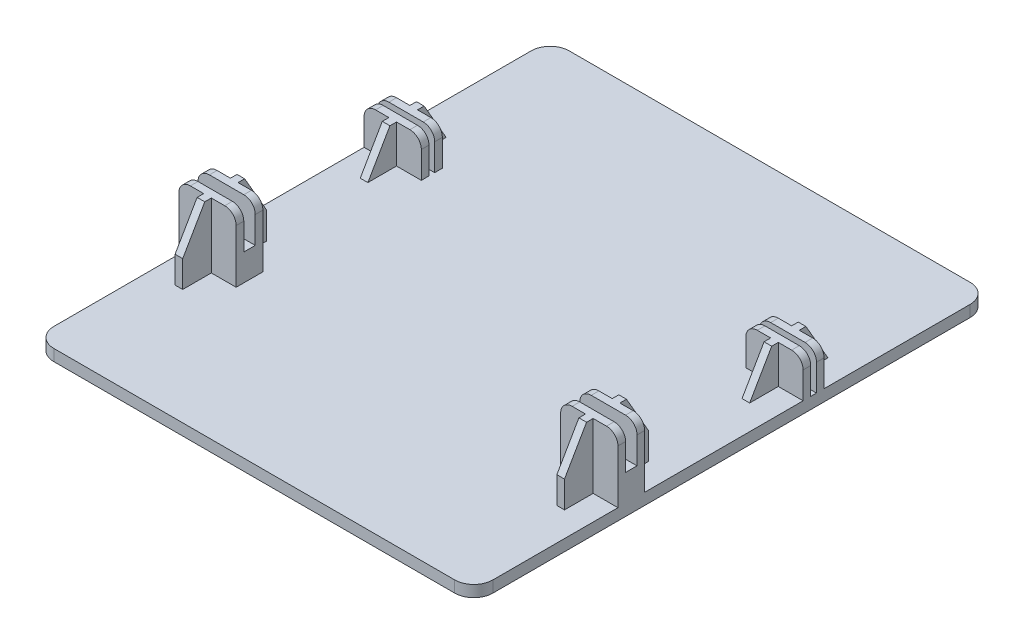
from build123d import *
from OCP.BRepFilletAPI import BRepFilletAPI_MakeChamfer

# Parameters (mm, degrees)
ESQUISSE1_W                    = 115
ESQUISSE1_H                    = 135
BOSS_EXTRU_1_DEPTH             = 3
BOSS_EXTRU_2_DEPTH             = 10
BOSS_EXTRU_3_DEPTH             = 7
ESQUISSE5_W                    = 15
ESQUISSE5_H                    = 3
BOSS_EXTRU_4_DEPTH             = 7
CHANFREIN1_SIZE                = 5.773502692
CHANFREIN1_SIZE_2              = 10
CONG_1_R                       = 3
CHANFREIN1_OF_SYM_TRIE1_SIZE   = 5.773502692
CHANFREIN1_OF_SYM_TRIE1_SIZE_2 = 10
CONG_1_OF_SYM_TRIE1_R          = 3
CONG_2_R                       = 5


with BuildPart() as part:
    # Esquisse1 → Boss.-Extru.1 (new body)
    with BuildSketch(Plane(origin=(0, 0, 0), x_dir=(1, 0, 0), z_dir=(0, 1, 0))):
        Rectangle(ESQUISSE1_W, ESQUISSE1_H)
    extrude(amount=BOSS_EXTRU_1_DEPTH)

    # Esquisse2 → Boss.-Extru.2 (add)
    with BuildSketch(Plane(origin=(0, 3, 0), x_dir=(1, 0, 0), z_dir=(0, 1, 0))):
        Polygon((-57.5, 24.25), (-51, 24.25), (-51, 31.75), (-49, 31.75), (-49, 24.25), (-42.5, 24.25), (-42.5, 22.25), (-57.5, 22.25), align=None)
        Polygon((-42.5, 18.75), (-42.5, 20.75), (-57.5, 20.75), (-57.5, 18.75), (-51, 18.75), (-51, 11.25), (-49, 11.25), (-49, 18.75), align=None)
        Polygon((-51, -22.75), (-51, -15.25), (-49, -15.25), (-49, -22.75), (-42.5, -22.75), (-42.5, -24.75), (-57.5, -24.75), (-57.5, -22.75), align=None)
        Polygon((-57.5, -29.75), (-51, -29.75), (-51, -37.25), (-49, -37.25), (-49, -29.75), (-42.5, -29.75), (-42.5, -27.75), (-57.5, -27.75), align=None)
    boss_extru_2 = extrude(amount=BOSS_EXTRU_2_DEPTH)

    # Esquisse4 → Boss.-Extru.3 (add)
    with BuildSketch(Plane(origin=(0, 13, 0), x_dir=(1, 0, 0), z_dir=(0, 1, 0))):
        Polygon((-57.5, -27.75), (-57.5, -29.75), (-51, -29.75), (-51, -37.25), (-49, -37.25), (-49, -29.75), (-42.5, -29.75), (-42.5, -27.75), align=None)
        Polygon((-51, -22.75), (-57.5, -22.75), (-57.5, -24.75), (-42.5, -24.75), (-42.5, -22.75), (-49, -22.75), (-49, -15.25), (-51, -15.25), align=None)
    boss_extru_3 = extrude(amount=BOSS_EXTRU_3_DEPTH)

    # Esquisse5 → Boss.-Extru.4 (add)
    with BuildSketch(Plane(origin=(0, 3, 0), x_dir=(1, 0, 0), z_dir=(0, 1, 0))):
        with Locations((-50, -26.25)):
            Rectangle(ESQUISSE5_W, ESQUISSE5_H)
    boss_extru_4 = extrude(amount=BOSS_EXTRU_4_DEPTH)

    # Chanfrein1
    chanfrein1_edges_1 = [part.edges().sort_by_distance(p)[0] for p in [
        (-50, 13, -31.75),
    ]]
    chanfrein1_side_1 = [part.faces().sort_by_distance(p)[0] for p in [
        (-50, 13, -31.634529946),
    ]]
    chanfrein1_edges_2 = [part.edges().sort_by_distance(p)[0] for p in [
        (-50, 13, -11.25),
    ]]
    chanfrein1_side_2 = [part.faces().sort_by_distance(p)[0] for p in [
        (-50, 13, -11.365470054),
    ]]
    chanfrein1_edges_3 = [part.edges().sort_by_distance(p)[0] for p in [
        (-50, 20, 37.25),
    ]]
    chanfrein1_side_3 = [part.faces().sort_by_distance(p)[0] for p in [
        (-50, 20, 37.134529946),
    ]]
    chanfrein1_edges_4 = [part.edges().sort_by_distance(p)[0] for p in [
        (-50, 20, 15.25),
    ]]
    chanfrein1_side_4 = [part.faces().sort_by_distance(p)[0] for p in [
        (-50, 20, 15.365470054),
    ]]
    chanfrein1 = BRepFilletAPI_MakeChamfer(part.part.solid().wrapped)
    for e in chanfrein1_edges_1:
        chanfrein1.Add(CHANFREIN1_SIZE - 0.0001, CHANFREIN1_SIZE_2 - 0.0001, e.wrapped, chanfrein1_side_1[0].wrapped)
    for e in chanfrein1_edges_2:
        chanfrein1.Add(CHANFREIN1_SIZE - 0.0001, CHANFREIN1_SIZE_2 - 0.0001, e.wrapped, chanfrein1_side_2[0].wrapped)
    for e in chanfrein1_edges_3:
        chanfrein1.Add(CHANFREIN1_SIZE - 0.0001, CHANFREIN1_SIZE_2 - 0.0001, e.wrapped, chanfrein1_side_3[0].wrapped)
    for e in chanfrein1_edges_4:
        chanfrein1.Add(CHANFREIN1_SIZE - 0.0001, CHANFREIN1_SIZE_2 - 0.0001, e.wrapped, chanfrein1_side_4[0].wrapped)
    add(Compound.cast(chanfrein1.Shape()), mode=Mode.REPLACE)  # a hair under: the kernel refuses the full size

    # Congé1
    cong_1_edges = [part.edges().sort_by_distance(p)[0] for p in [
        (-57.5, 20, 28.75),
        (-42.5, 20, 28.75),
        (-57.5, 20, 23.75),
        (-42.5, 20, 23.75),
        (-57.5, 13, -23.25),
        (-42.5, 13, -23.25),
        (-42.5, 13, -19.75),
        (-57.5, 13, -19.75),
    ]]
    fillet(cong_1_edges, radius=CONG_1_R)

    # Symétrie1: Boss.-Extru.2, Boss.-Extru.3, Boss.-Extru.4 across plane
    add(boss_extru_2.mirror(Plane(origin=(0, 0, 0), x_dir=(0, 0, 1), z_dir=(1, 0, 0))))
    add(boss_extru_3.mirror(Plane(origin=(0, 0, 0), x_dir=(0, 0, 1), z_dir=(1, 0, 0))))
    add(boss_extru_4.mirror(Plane(origin=(0, 0, 0), x_dir=(0, 0, 1), z_dir=(1, 0, 0))))

    # Chanfrein1 of Symétrie1
    chanfrein1_of_sym_trie1_edges_1 = [part.edges().sort_by_distance(p)[0] for p in [
        (50, 13, -31.75),
    ]]
    chanfrein1_of_sym_trie1_side_1 = [part.faces().sort_by_distance(p)[0] for p in [
        (50, 13, -31.634529946),
    ]]
    chanfrein1_of_sym_trie1_edges_2 = [part.edges().sort_by_distance(p)[0] for p in [
        (50, 13, -11.25),
    ]]
    chanfrein1_of_sym_trie1_side_2 = [part.faces().sort_by_distance(p)[0] for p in [
        (50, 13, -11.365470054),
    ]]
    chanfrein1_of_sym_trie1_edges_3 = [part.edges().sort_by_distance(p)[0] for p in [
        (50, 20, 37.25),
    ]]
    chanfrein1_of_sym_trie1_side_3 = [part.faces().sort_by_distance(p)[0] for p in [
        (50, 20, 37.134529946),
    ]]
    chanfrein1_of_sym_trie1_edges_4 = [part.edges().sort_by_distance(p)[0] for p in [
        (50, 20, 15.25),
    ]]
    chanfrein1_of_sym_trie1_side_4 = [part.faces().sort_by_distance(p)[0] for p in [
        (50, 20, 15.365470054),
    ]]
    chanfrein1_of_sym_trie1 = BRepFilletAPI_MakeChamfer(part.part.solid().wrapped)
    for e in chanfrein1_of_sym_trie1_edges_1:
        chanfrein1_of_sym_trie1.Add(CHANFREIN1_OF_SYM_TRIE1_SIZE - 0.0001, CHANFREIN1_OF_SYM_TRIE1_SIZE_2 - 0.0001, e.wrapped, chanfrein1_of_sym_trie1_side_1[0].wrapped)
    for e in chanfrein1_of_sym_trie1_edges_2:
        chanfrein1_of_sym_trie1.Add(CHANFREIN1_OF_SYM_TRIE1_SIZE - 0.0001, CHANFREIN1_OF_SYM_TRIE1_SIZE_2 - 0.0001, e.wrapped, chanfrein1_of_sym_trie1_side_2[0].wrapped)
    for e in chanfrein1_of_sym_trie1_edges_3:
        chanfrein1_of_sym_trie1.Add(CHANFREIN1_OF_SYM_TRIE1_SIZE - 0.0001, CHANFREIN1_OF_SYM_TRIE1_SIZE_2 - 0.0001, e.wrapped, chanfrein1_of_sym_trie1_side_3[0].wrapped)
    for e in chanfrein1_of_sym_trie1_edges_4:
        chanfrein1_of_sym_trie1.Add(CHANFREIN1_OF_SYM_TRIE1_SIZE - 0.0001, CHANFREIN1_OF_SYM_TRIE1_SIZE_2 - 0.0001, e.wrapped, chanfrein1_of_sym_trie1_side_4[0].wrapped)
    add(Compound.cast(chanfrein1_of_sym_trie1.Shape()), mode=Mode.REPLACE)  # a hair under: the kernel refuses the full size

    # Congé1 of Symétrie1
    cong_1_of_sym_trie1_edges = [part.edges().sort_by_distance(p)[0] for p in [
        (57.5, 20, 28.75),
        (42.5, 20, 28.75),
        (57.5, 20, 23.75),
        (42.5, 20, 23.75),
        (57.5, 13, -23.25),
        (42.5, 13, -23.25),
        (42.5, 13, -19.75),
        (57.5, 13, -19.75),
    ]]
    fillet(cong_1_of_sym_trie1_edges, radius=CONG_1_OF_SYM_TRIE1_R)

    # Congé2
    cong_2_edges = [part.edges().sort_by_distance(p)[0] for p in [
        (57.5, 1.5, 67.5),
        (-57.5, 1.5, 67.5),
        (-57.5, 1.5, -67.5),
        (57.5, 1.5, -67.5),
    ]]
    fillet(cong_2_edges, radius=CONG_2_R)


solid = part.part
